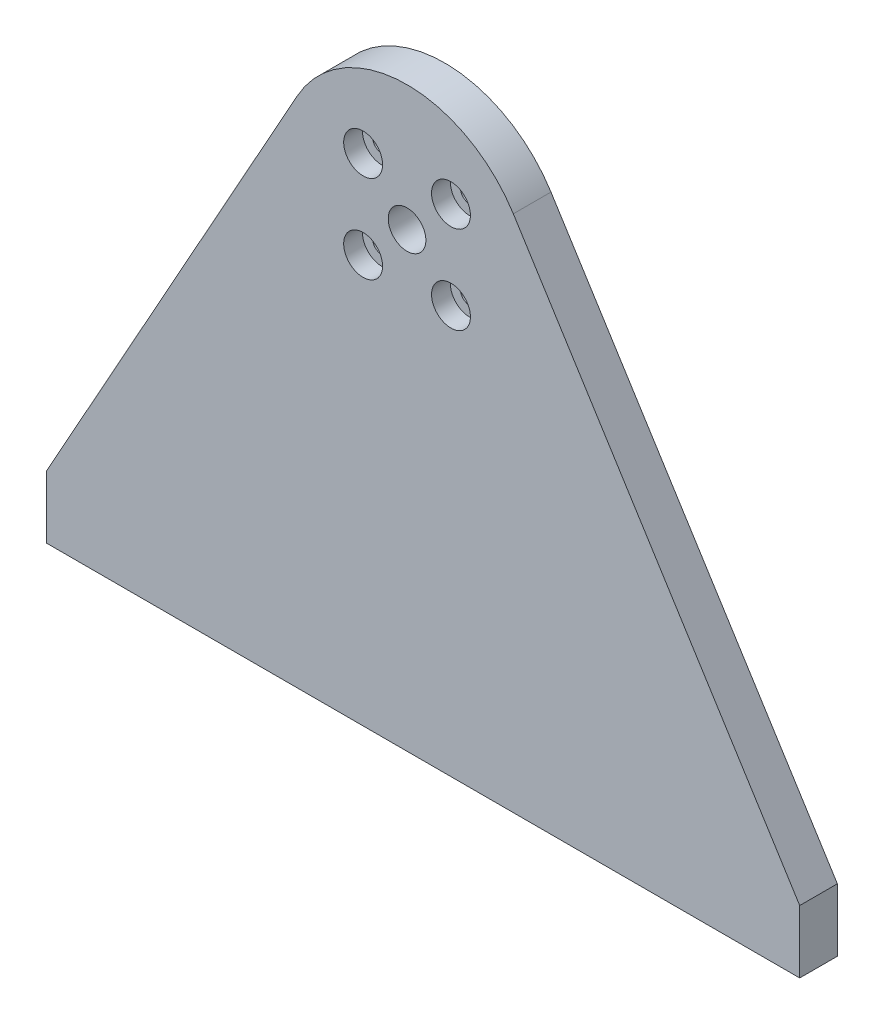
from build123d import *

# Parameters (mm, degrees)
SKETCH_1_R          = 3
EXTRUDE_1_DEPTH     = 6
SKETCH_2_R          = 3.1
CUT_EXTRUDE_6_DEPTH = 3
SKETCH_4_R          = 1.5
CUT_EXTRUDE_7_DEPTH = 120.751589729


with BuildPart() as part:
    # 草图1 → 凸台-拉伸1 (new body)
    with BuildSketch(Plane.XY):
        with BuildLine():
            Line((53.211823486, 15.105307707), (98.846336292, -57.534028788))
            Line((98.846336292, -57.534028788), (98.846336292, -67.534028788))
            Line((98.846336292, -67.534028788), (-21.153663708, -67.534028788))
            Line((-21.153663708, -67.534028788), (-21.153663708, -57.534028788))
            Line((-21.153663708, -57.534028788), (18.804405563, 14.198660069))
            ThreePointArc((18.804405563, 14.198660069), (35.749695352, 24.459031414), (53.211823486, 15.105307707))
        make_face()
        with Locations((36.276519563, 4.465971212)):
            Circle(SKETCH_1_R, mode=Mode.SUBTRACT)
    extrude(amount=EXTRUDE_1_DEPTH)

    # 草图2 → 切除-拉伸6 (cut)
    with BuildSketch(Plane.XY.offset(6)):
        with Locations((29.276519563, 11.465971212)):
            Circle(SKETCH_2_R)
        with Locations((43.276519563, 11.465971212)):
            Circle(SKETCH_2_R)
        with Locations((43.276519563, -2.534028788)):
            Circle(SKETCH_2_R)
        with Locations((29.276519563, -2.534028788)):
            Circle(SKETCH_2_R)
    extrude(amount=-CUT_EXTRUDE_6_DEPTH, mode=Mode.SUBTRACT)

    # 草图4 → 切除-拉伸7 (cut, through all)
    with BuildSketch(Plane.XY.offset(3)):
        with Locations((43.276519563, 11.465971212)):
            Circle(SKETCH_4_R)
        with Locations((43.276519563, -2.534028788)):
            Circle(SKETCH_4_R)
        with Locations((29.276519563, -2.534028788)):
            Circle(SKETCH_4_R)
        with Locations((29.276519563, 11.465971212)):
            Circle(SKETCH_4_R)
    extrude(amount=-CUT_EXTRUDE_7_DEPTH, mode=Mode.SUBTRACT)


solid = part.part
